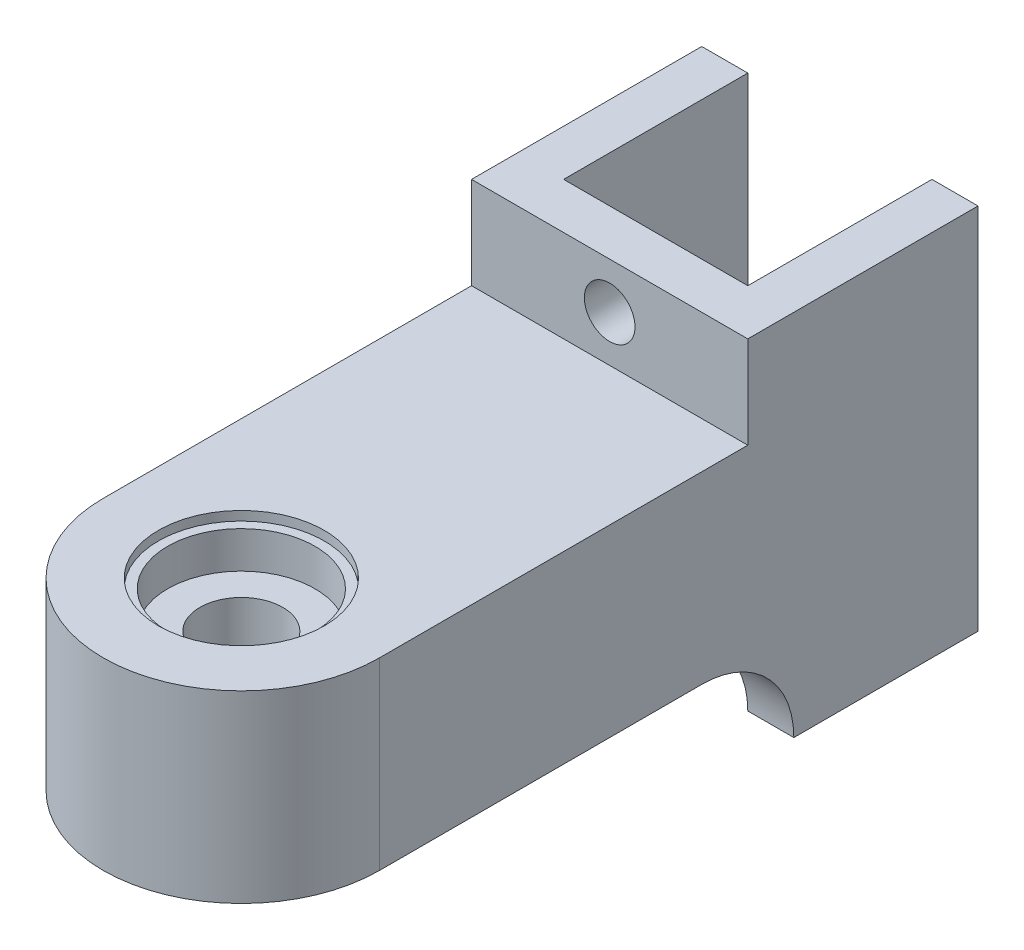
from build123d import *

# Parameters (mm, degrees)
BOSS_EXTRUDE1_DEPTH      = 10
BOSS_EXTRUDE1_DEPTH_BACK = 10
SKETCH1_R                = 9
BOSS_EXTRUDE2_DEPTH      = 9
BOSS_EXTRUDE2_DEPTH_BACK = 9
BOSS_EXTRUDE4_DEPTH      = 5
BOSS_EXTRUDE4_DEPTH_BACK = 5
BOSS_EXTRUDE3_DEPTH      = 10
BOSS_EXTRUDE3_DEPTH_BACK = 30
SKETCH2_W                = 5
SKETCH2_H                = 20
SKETCH6_W                = 30
SKETCH6_H                = 5
BOSS_EXTRUDE6_DEPTH      = 10
FILLET1_R                = 10
M5_CLEARANCE_HOLE1_D     = 5.5


with BuildPart() as part:
    # Sketch1 → Boss-Extrude1 (new, two sides: drawn at the far end of the back side and taken through both)
    with BuildSketch(Plane(origin=(0, 0, 0), x_dir=(1, 0, 0), z_dir=(0, 1, 0)).offset(-BOSS_EXTRUDE1_DEPTH_BACK)):
        with BuildLine():
            Line((-9.406779661, -11.355932203), (-9.406779661, 8.644067797))
            Line((-9.406779661, 8.644067797), (-14.406779661, 8.644067797))
            Line((-14.406779661, 8.644067797), (-14.406779661, -56.355932203))
            ThreePointArc((-14.406779661, -56.355932203), (0.593220339, -71.355932203), (15.593220339, -56.355932203))
            Line((15.593220339, -56.355932203), (15.593220339, 8.644067797))
            Line((15.593220339, 8.644067797), (10.593220339, 8.644067797))
            Line((10.593220339, 8.644067797), (10.593220339, -11.355932203))
            Line((10.593220339, -11.355932203), (-9.406779661, -11.355932203))
        make_face()
        with Locations(Location((0.593220339, -56.355932203, 0), (0, 0, 270))):
            Circle(SKETCH1_R, mode=Mode.SUBTRACT)
    extrude(amount=BOSS_EXTRUDE1_DEPTH + BOSS_EXTRUDE1_DEPTH_BACK)

    # Sketch1<3> → Boss-Extrude2 (add, two sides: drawn at the far end of the back side and taken through both)
    # profile 1 of 2: a face of its own
    with BuildSketch(Plane(origin=(0, 0, 0), x_dir=(1, 0, 0), z_dir=(0, 1, 0)).offset(-BOSS_EXTRUDE2_DEPTH_BACK)):
        with BuildLine():
            ThreePointArc((9.593220339, -56.355932203), (6.95718137, -49.991971173), (0.593220339, -47.355932203))
            ThreePointArc((0.593220339, -47.355932203), (-5.770740692, -62.719893234), (9.593220339, -56.355932203))
        make_face()
        with BuildLine():
            ThreePointArc((8.593220339, -56.355932203), (-5.063633911, -62.012786453), (0.593220339, -48.355932203))
            ThreePointArc((0.593220339, -48.355932203), (6.250074588, -50.699077954), (8.593220339, -56.355932203))
        make_face(mode=Mode.SUBTRACT)
    # profile 2 of 2: a face of its own
    with BuildSketch(Plane(origin=(0, 0, 0), x_dir=(1, 0, 0), z_dir=(0, 1, 0)).offset(-BOSS_EXTRUDE2_DEPTH_BACK)):
        with BuildLine():
            ThreePointArc((9.593220339, -56.355932203), (6.95718137, -49.991971173), (0.593220339, -47.355932203))
            ThreePointArc((0.593220339, -47.355932203), (-5.770740692, -62.719893234), (9.593220339, -56.355932203))
        make_face()
        with BuildLine():
            ThreePointArc((8.593220339, -56.355932203), (-5.063633911, -62.012786453), (0.593220339, -48.355932203))
            ThreePointArc((0.593220339, -48.355932203), (6.250074588, -50.699077954), (8.593220339, -56.355932203))
        make_face(mode=Mode.SUBTRACT)
    extrude(amount=BOSS_EXTRUDE2_DEPTH + BOSS_EXTRUDE2_DEPTH_BACK)

    # Sketch1<4> → Boss-Extrude4 (add, two sides: drawn at the far end of the back side and taken through both)
    # profile 1 of 2: a face of its own
    with BuildSketch(Plane(origin=(0, 0, 0), x_dir=(1, 0, 0), z_dir=(0, 1, 0)).offset(-BOSS_EXTRUDE4_DEPTH_BACK)):
        with BuildLine():
            ThreePointArc((8.593220339, -56.355932203), (6.250074588, -50.699077954), (0.593220339, -48.355932203))
            ThreePointArc((0.593220339, -48.355932203), (-5.063633911, -62.012786453), (8.593220339, -56.355932203))
        make_face()
        with BuildLine():
            ThreePointArc((5.093220339, -56.355932203), (-2.588760176, -59.537912719), (0.593220339, -51.855932203))
            ThreePointArc((0.593220339, -51.855932203), (3.775200854, -53.173951688), (5.093220339, -56.355932203))
        make_face(mode=Mode.SUBTRACT)
    # profile 2 of 2: a face of its own
    with BuildSketch(Plane(origin=(0, 0, 0), x_dir=(1, 0, 0), z_dir=(0, 1, 0)).offset(-BOSS_EXTRUDE4_DEPTH_BACK)):
        with BuildLine():
            ThreePointArc((8.593220339, -56.355932203), (6.250074588, -50.699077954), (0.593220339, -48.355932203))
            ThreePointArc((0.593220339, -48.355932203), (-5.063633911, -62.012786453), (8.593220339, -56.355932203))
        make_face()
        with BuildLine():
            ThreePointArc((5.093220339, -56.355932203), (-2.588760176, -59.537912719), (0.593220339, -51.855932203))
            ThreePointArc((0.593220339, -51.855932203), (3.775200854, -53.173951688), (5.093220339, -56.355932203))
        make_face(mode=Mode.SUBTRACT)
    extrude(amount=BOSS_EXTRUDE4_DEPTH + BOSS_EXTRUDE4_DEPTH_BACK)

    # Sketch2 → Boss-Extrude3 (add, two sides: drawn at the far end of the back side and taken through both)
    with BuildSketch(Plane(origin=(0, 10, 0), x_dir=(1, 0, 0), z_dir=(0, 1, 0)).offset(-BOSS_EXTRUDE3_DEPTH_BACK)):
        with Locations((13.093220339, -1.355932203)):
            Rectangle(SKETCH2_W, SKETCH2_H)
        with Locations((-11.906779661, -1.355932203)):
            Rectangle(SKETCH2_W, SKETCH2_H)
    extrude(amount=BOSS_EXTRUDE3_DEPTH + BOSS_EXTRUDE3_DEPTH_BACK)

    # Sketch6 → Boss-Extrude6 (add)
    with BuildSketch(Plane(origin=(0, 10, 0), x_dir=(1, 0, 0), z_dir=(0, 1, 0))):
        with Locations((0.593220339, -13.855932203)):
            Rectangle(SKETCH6_W, SKETCH6_H)
    extrude(amount=BOSS_EXTRUDE6_DEPTH)

    # Fillet1
    fillet1_edges = [part.edges().sort_by_distance(p)[0] for p in [
        (-11.906779661, -10, 11.355932203),
        (13.093220339, -10, 11.355932203),
    ]]
    fillet(fillet1_edges, radius=FILLET1_R - 0.0001)  # a hair under: the kernel refuses the full size

    # M5 Clearance Hole1 (through all)
    with Locations(Plane.XY.offset(16.355932203)):
        with Locations((0.593220339, 15)):
            Hole(M5_CLEARANCE_HOLE1_D / 2)


solid = part.part
